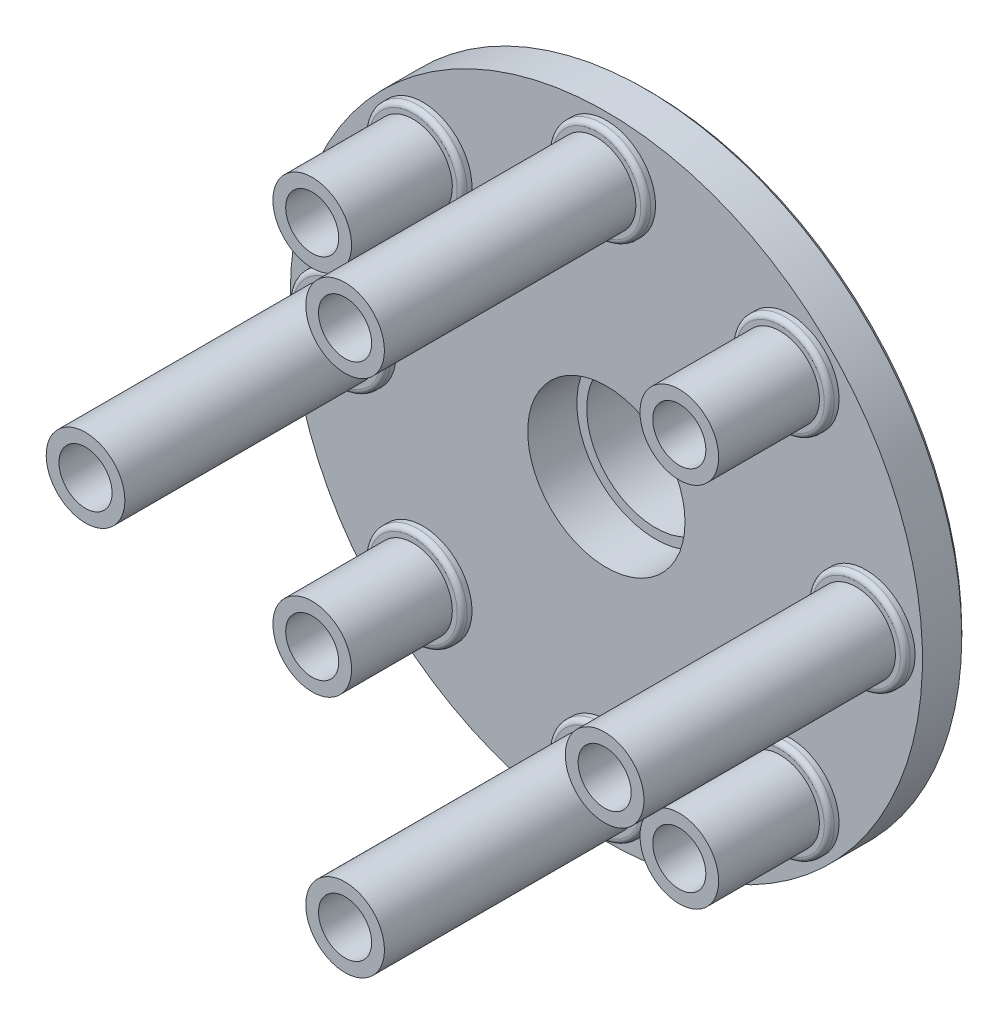
from build123d import *

# Parameters (mm, degrees)
SKETCH1_R                = 32.15
SKETCH1_R_2              = 2.7
BOSS_EXTRUDE1_DEPTH      = 4
SKETCH2_R                = 4
SKETCH2_R_2              = 2.7
BOSS_EXTRUDE2_DEPTH      = 27.07546845
SKETCH3_R                = 5
SKETCH3_R_2              = 4
BOSS_EXTRUDE3_DEPTH      = 1.5
FILLET2_R                = 0.5
CIRPATTERN1_COUNT        = 8
FILLET2_OF_CIRPATTERN1_R = 0.5
CHAMFER1_SIZE            = 0.5
SKETCH9_R                = 8
CUT_EXTRUDE4_DEPTH       = 53.918106464
BOSS_EXTRUDE7_START      = -6.5
SKETCH10_R               = 8
SKETCH10_R_2             = 6.5
BOSS_EXTRUDE7_DEPTH      = 6.5
CUT_EXTRUDE5_DEPTH       = 53.918106464
CUT_EXTRUDE5_DEPTH_BACK  = 53.918106464
SKETCH14_R               = 16.1
SKETCH15_R               = 16.1
SKETCH15_R_2             = 15.1
BOSS_EXTRUDE8_DEPTH      = 1.5
SKETCH16_R               = 18.1
SKETCH16_R_2             = 16.1
BOSS_EXTRUDE9_DEPTH      = 4.5
CHAMFER3_SIZE2           = 4.5
CHAMFER3_SIZE            = 2
CUT_EXTRUDE3_START       = -5
SKETCH7_R                = 4.45
CUT_EXTRUDE3_DEPTH       = 61.072041358
CIRPATTERN2_COUNT        = 8
CHAMFER4_SIZE            = 0.5
SKETCH17_R               = 6.596186261
CUT_EXTRUDE6_DEPTH       = 15.32546845
CIRPATTERN3_COUNT        = 4
BOSS_EXTRUDE11_START     = -2
SKETCH19_R               = 15.1
BOSS_EXTRUDE11_DEPTH     = 2
SKETCH18_R               = 10
SKETCH18_R_2             = 8
BOSS_EXTRUDE10_DEPTH     = 16
SKETCH20_R               = 8
CUT_EXTRUDE7_DEPTH       = 6.5
BOSS_EXTRUDE12_START     = -5
SKETCH23_R               = 8
SKETCH23_R_2             = 7
BOSS_EXTRUDE12_DEPTH     = 1.5
CHAMFER6_SIZE            = 0.5
CUT_EXTRUDE8_DEPTH       = 57.224830931
CUT_EXTRUDE8_DEPTH_BACK  = 57.224830931
SKETCH24_R               = 7
SKETCH25_R               = 32.15
SKETCH25_R_2             = 5
SKETCH25_R_3             = 15.1
BOSS_EXTRUDE13_DEPTH     = 0.5


with BuildPart() as part:
    # Sketch1 → Boss-Extrude1 (new body)
    with BuildSketch(Plane.XY):
        Circle(SKETCH1_R)
        with Locations((0, 26.4)):
            Circle(SKETCH1_R_2, mode=Mode.SUBTRACT)
        with Locations((26.4, 0)):
            Circle(SKETCH1_R_2, mode=Mode.SUBTRACT)
        with Locations((0, -26.4)):
            Circle(SKETCH1_R_2, mode=Mode.SUBTRACT)
        with Locations((-26.4, 0)):
            Circle(SKETCH1_R_2, mode=Mode.SUBTRACT)
    extrude(amount=BOSS_EXTRUDE1_DEPTH)

    # Sketch2 → Boss-Extrude2 (add)
    with BuildSketch(Plane.XY.offset(4)):
        with Locations((0, 26.4)):
            Circle(SKETCH2_R)
        with Locations((0, 26.4)):
            Circle(SKETCH2_R_2, mode=Mode.SUBTRACT)
    boss_extrude2 = extrude(amount=BOSS_EXTRUDE2_DEPTH)

    # Sketch3 → Boss-Extrude3 (add)
    with BuildSketch(Plane.XY.offset(4)):
        with Locations((0, 26.4)):
            Circle(SKETCH3_R)
        with Locations((0, 26.4)):
            Circle(SKETCH3_R_2, mode=Mode.SUBTRACT)
    boss_extrude3 = extrude(amount=BOSS_EXTRUDE3_DEPTH)

    # Fillet2
    fillet2_edges = [part.edges().sort_by_distance(p)[0] for p in [
        (-5, 26.4, 5.5),
    ]]
    fillet(fillet2_edges, radius=FILLET2_R)

    # CirPattern1: Boss-Extrude2, Boss-Extrude3 ×8 about axis
    cirpattern1_axis = Axis((0, 0, 0), (0, 0, 1))
    add([boss_extrude2.rotate(cirpattern1_axis, i * 360 / CIRPATTERN1_COUNT) for i in range(1, CIRPATTERN1_COUNT)])
    add([boss_extrude3.rotate(cirpattern1_axis, i * 360 / CIRPATTERN1_COUNT) for i in range(1, CIRPATTERN1_COUNT)])

    # Fillet2 of CirPattern1
    fillet2_of_cirpattern1_edges = [part.edges().sort_by_distance(p)[0] for p in [
        (-22.203152929, 15.132085117, 5.5),
        (-26.4, -5, 5.5),
        (-15.132085117, -22.203152929, 5.5),
        (5, -26.4, 5.5),
        (22.203152929, -15.132085117, 5.5),
        (26.4, 5, 5.5),
        (15.132085117, 22.203152929, 5.5),
    ]]
    fillet(fillet2_of_cirpattern1_edges, radius=FILLET2_OF_CIRPATTERN1_R)

    # Chamfer1
    chamfer1_edges = [part.edges().sort_by_distance(p)[0] for p in [
        (-32.15, 0, 0),
    ]]
    chamfer(chamfer1_edges, length=CHAMFER1_SIZE)

    # Sketch9 → Cut-Extrude4 (cut, through all)
    with BuildSketch(Plane.XY.offset(4)):
        Circle(SKETCH9_R)
    extrude(amount=-CUT_EXTRUDE4_DEPTH, mode=Mode.SUBTRACT)

    # Sketch10 → Boss-Extrude7 (add)
    with BuildSketch(Plane(origin=(0, 0, 0), x_dir=(-1, 0, 0), z_dir=(0, 0, -1)).offset(BOSS_EXTRUDE7_START)):
        Circle(SKETCH10_R)
        Circle(SKETCH10_R_2, mode=Mode.SUBTRACT)
    extrude(amount=BOSS_EXTRUDE7_DEPTH)

    # Sketch14 → Cut-Extrude5 (cut, two sides: drawn at the far end of the back side and taken through both)
    with BuildSketch(Plane.XY.offset(4).offset(-CUT_EXTRUDE5_DEPTH_BACK)):
        Circle(SKETCH14_R)
    extrude(amount=CUT_EXTRUDE5_DEPTH + CUT_EXTRUDE5_DEPTH_BACK, mode=Mode.SUBTRACT)

    # Sketch15 → Boss-Extrude8 (add)
    with BuildSketch(Plane.XY.offset(4)):
        Circle(SKETCH15_R)
        Circle(SKETCH15_R_2, mode=Mode.SUBTRACT)
    extrude(amount=-BOSS_EXTRUDE8_DEPTH)

    # Sketch16 → Boss-Extrude9 (add)
    with BuildSketch(Plane(origin=(0, 0, 0), x_dir=(-1, 0, 0), z_dir=(0, 0, -1))):
        with Locations(Location((0, 0, 0), (0, 0, 180))):
            Circle(SKETCH16_R)
        with Locations(Location((0, 0, 0), (0, 0, 180))):
            Circle(SKETCH16_R_2, mode=Mode.SUBTRACT)
    extrude(amount=BOSS_EXTRUDE9_DEPTH)

    # Chamfer3
    chamfer3_edges = [part.edges().sort_by_distance(p)[0] for p in [
        (-18.1, 0, 0),
    ]]
    chamfer3_side = [part.faces().sort_by_distance(p)[0] for p in [
        (-18.14, 0, 0),
    ]]
    chamfer(chamfer3_edges, length=CHAMFER3_SIZE - 0.0001, length2=CHAMFER3_SIZE2 - 0.0001, reference=chamfer3_side[0])  # a hair under: the kernel refuses the full size

    # Sketch7 → Cut-Extrude3 (cut)
    with BuildSketch(Plane(origin=(0, 0, 0), x_dir=(-1, 0, 0), z_dir=(0, 0, -1)).offset(CUT_EXTRUDE3_START)):
        with Locations(Location((0, 26.4, 0), (0, 0, 180))):
            Circle(SKETCH7_R)
    cut_extrude3 = extrude(amount=CUT_EXTRUDE3_DEPTH, mode=Mode.SUBTRACT)

    # CirPattern2: Cut-Extrude3 ×8 about axis
    cirpattern2_axis = Axis((0, 0, 0), (0, 0, 1))
    for i in range(1, CIRPATTERN2_COUNT):
        add(cut_extrude3.rotate(cirpattern2_axis, i * 360 / CIRPATTERN2_COUNT), mode=Mode.SUBTRACT)

    # Chamfer4
    chamfer4_edges = [part.edges().sort_by_distance(p)[0] for p in [
        (-16.1, 0, -4.5),
    ]]
    chamfer(chamfer4_edges, length=CHAMFER4_SIZE)

    # Sketch17 → Cut-Extrude6 (cut)
    with BuildSketch(Plane.XY.offset(31.07546845)):
        with Locations((-18.667619023, 18.667619023)):
            Circle(SKETCH17_R)
    cut_extrude6 = extrude(amount=-CUT_EXTRUDE6_DEPTH, mode=Mode.SUBTRACT)

    # CirPattern3: Cut-Extrude6 ×4 about axis
    cirpattern3_axis = Axis((0, 0, 4), (0, 0, 1))
    for i in range(1, CIRPATTERN3_COUNT):
        add(cut_extrude6.rotate(cirpattern3_axis, i * 360 / CIRPATTERN3_COUNT), mode=Mode.SUBTRACT)

    # Sketch19 → Boss-Extrude11 (add)
    with BuildSketch(Plane(origin=(0, 0, 2.5), x_dir=(-1, 0, 0), z_dir=(0, 0, -1)).offset(BOSS_EXTRUDE11_START)):
        Circle(SKETCH19_R)
    extrude(amount=BOSS_EXTRUDE11_DEPTH)

    # Sketch18 → Boss-Extrude10 (add)
    # profile 1 of 2: a face of its own
    with BuildSketch(Plane(origin=(0, 0, 2.5), x_dir=(-1, 0, 0), z_dir=(0, 0, -1))):
        with Locations(Location((0, 0, 0), (0, 0, 180))):
            Circle(SKETCH18_R)
        Circle(SKETCH18_R_2, mode=Mode.SUBTRACT)
    # profile 2 of 2: a face of its own
    with BuildSketch(Plane(origin=(0, 0, 2.5), x_dir=(-1, 0, 0), z_dir=(0, 0, -1))):
        Circle(SKETCH18_R_2)
    extrude(amount=BOSS_EXTRUDE10_DEPTH)

    # Sketch20 → Cut-Extrude7 (cut)
    with BuildSketch(Plane.XY.offset(4.5)):
        Circle(SKETCH20_R)
    extrude(amount=-CUT_EXTRUDE7_DEPTH, mode=Mode.SUBTRACT)

    # Sketch23 → Boss-Extrude12 (add)
    with BuildSketch(Plane.XY.offset(4.5).offset(BOSS_EXTRUDE12_START)):
        Circle(SKETCH23_R)
        Circle(SKETCH23_R_2, mode=Mode.SUBTRACT)
    extrude(amount=-BOSS_EXTRUDE12_DEPTH)

    # Chamfer6
    chamfer6_edges = [part.edges().sort_by_distance(p)[0] for p in [
        (-10, 0, -13.5),
    ]]
    chamfer(chamfer6_edges, length=CHAMFER6_SIZE)

    # Sketch24 → Cut-Extrude8 (cut, two sides: drawn at the far end of the back side and taken through both)
    with BuildSketch(Plane.XY.offset(-2).offset(-CUT_EXTRUDE8_DEPTH_BACK)):
        Circle(SKETCH24_R)
    extrude(amount=CUT_EXTRUDE8_DEPTH + CUT_EXTRUDE8_DEPTH_BACK, mode=Mode.SUBTRACT)

    # Sketch25 → Boss-Extrude13 (add)
    with BuildSketch(Plane.XY.offset(4)):
        with Locations(Location((0, 0, 0), (0, 0, 180))):
            Circle(SKETCH25_R)
        with Locations(Location((-18.667619023, -18.667619023, 0), (0, 0, 180))):
            Circle(SKETCH25_R_2, mode=Mode.SUBTRACT)
        with Locations(Location((0, -26.4, 0), (0, 0, 180))):
            Circle(SKETCH25_R_2, mode=Mode.SUBTRACT)
        with Locations(Location((18.667619023, -18.667619023, 0), (0, 0, 180))):
            Circle(SKETCH25_R_2, mode=Mode.SUBTRACT)
        with Locations(Location((26.4, 0, 0), (0, 0, 180))):
            Circle(SKETCH25_R_2, mode=Mode.SUBTRACT)
        with Locations(Location((-26.4, 0, 0), (0, 0, 180))):
            Circle(SKETCH25_R_2, mode=Mode.SUBTRACT)
        with Locations(Location((-18.667619023, 18.667619023, 0), (0, 0, 180))):
            Circle(SKETCH25_R_2, mode=Mode.SUBTRACT)
        Circle(SKETCH25_R_3, mode=Mode.SUBTRACT)
        with Locations(Location((0, 26.4, 0), (0, 0, 180))):
            Circle(SKETCH25_R_2, mode=Mode.SUBTRACT)
        with Locations(Location((18.667619023, 18.667619023, 0), (0, 0, 180))):
            Circle(SKETCH25_R_2, mode=Mode.SUBTRACT)
    extrude(amount=BOSS_EXTRUDE13_DEPTH)


solid = part.part
